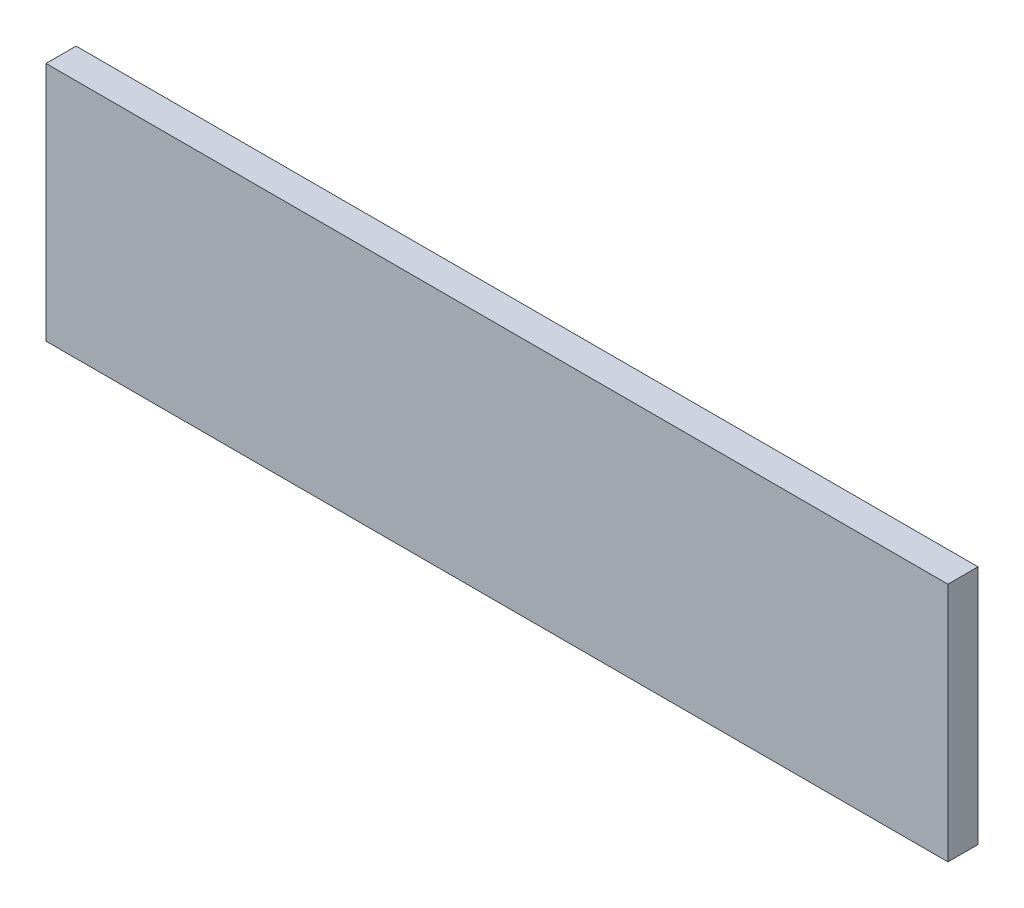
from build123d import *

# Parameters (mm, degrees)
SKETCH_1_W      = 150
SKETCH_1_H      = 40
EXTRUDE_1_DEPTH = 5


with BuildPart() as part:
    # ｽｹｯﾁ1 → ﾎﾞｽ - 押し出し1 (new body)
    with BuildSketch(Plane.XY):
        Rectangle(SKETCH_1_W, SKETCH_1_H)
    extrude(amount=EXTRUDE_1_DEPTH)


solid = part.part
